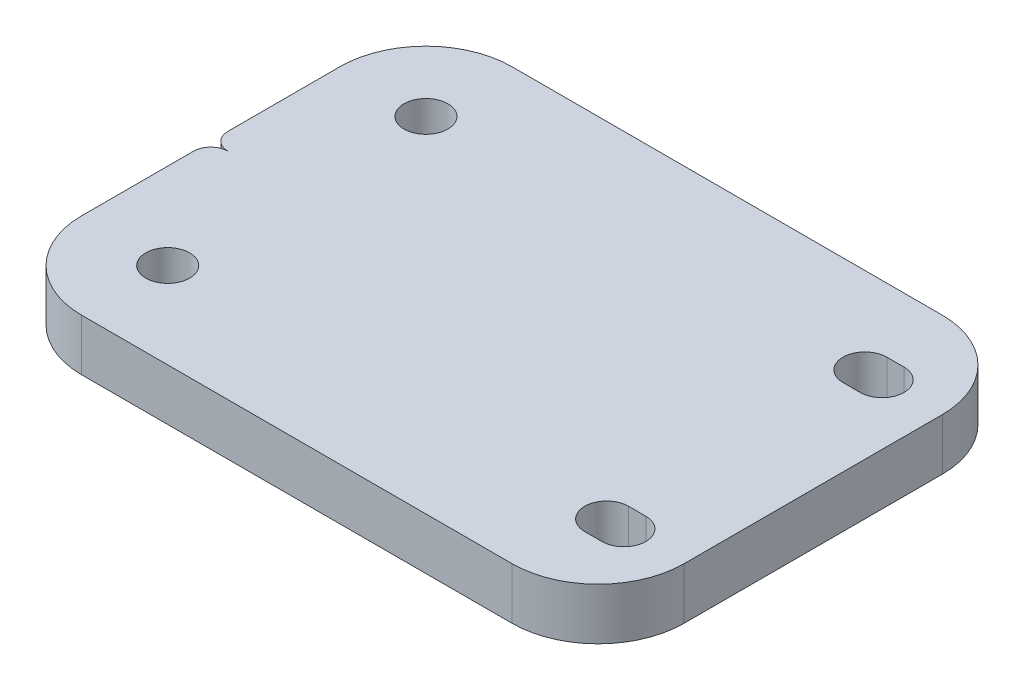
from build123d import *

# Parameters (mm, degrees)
EXTRUDE_1_DEPTH     = 6
SKETCH_2_R          = 2.55
CUT_EXTRUDE_1_DEPTH = 44.428101501
CUT_EXTRUDE_2_DEPTH = 44.428101501


with BuildPart() as part:
    # Эскиз1 → Бобышка-Вытянуть1 (new body)
    with BuildSketch(Plane(origin=(0, 0, 0), x_dir=(1, 0, 0), z_dir=(0, 1, 0))):
        with BuildLine():
            Line((-25, -25), (25, -25))
            ThreePointArc((25, -25), (32.071067812, -22.071067812), (35, -15))
            Line((35, -15), (35, 15))
            ThreePointArc((35, 15), (32.071067812, 22.071067812), (25, 25))
            Line((25, 25), (-25, 25))
            ThreePointArc((-25, 25), (-32.071067812, 22.071067812), (-35, 15))
            Line((-35, 15), (-35, -15))
            ThreePointArc((-35, -15), (-32.071067812, -22.071067812), (-25, -25))
        make_face()
    extrude(amount=EXTRUDE_1_DEPTH)

    # Эскиз2 → Вырез-Вытянуть1 (cut, through all)
    with BuildSketch(Plane.XZ):
        with Locations((-25, -15)):
            Circle(SKETCH_2_R)
        with Locations((-25, 15)):
            Circle(SKETCH_2_R)
        with BuildLine():
            Line((28, -17.55), (26, -17.55))
            ThreePointArc((26, -17.55), (23.45, -15), (26, -12.45))
            Line((26, -12.45), (28, -12.45))
            ThreePointArc((28, -12.45), (30.55, -15), (28, -17.55))
        make_face()
        with BuildLine():
            Line((28, 17.55), (26, 17.55))
            ThreePointArc((26, 17.55), (23.45, 15), (26, 12.45))
            Line((26, 12.45), (28, 12.45))
            ThreePointArc((28, 12.45), (30.55, 15), (28, 17.55))
        make_face()
    extrude(amount=-CUT_EXTRUDE_1_DEPTH, mode=Mode.SUBTRACT)

    # Эскиз3 → Вырез-Вытянуть2 (cut, through all)
    with BuildSketch(Plane.XZ):
        with BuildLine():
            Line((-35, -2), (-35, 2))
            ThreePointArc((-35, 2), (-34.414213562, 0.585786438), (-33, 0))
            ThreePointArc((-33, 0), (-34.414213562, -0.585786438), (-35, -2))
        make_face()
    extrude(amount=-CUT_EXTRUDE_2_DEPTH, mode=Mode.SUBTRACT)


solid = part.part
